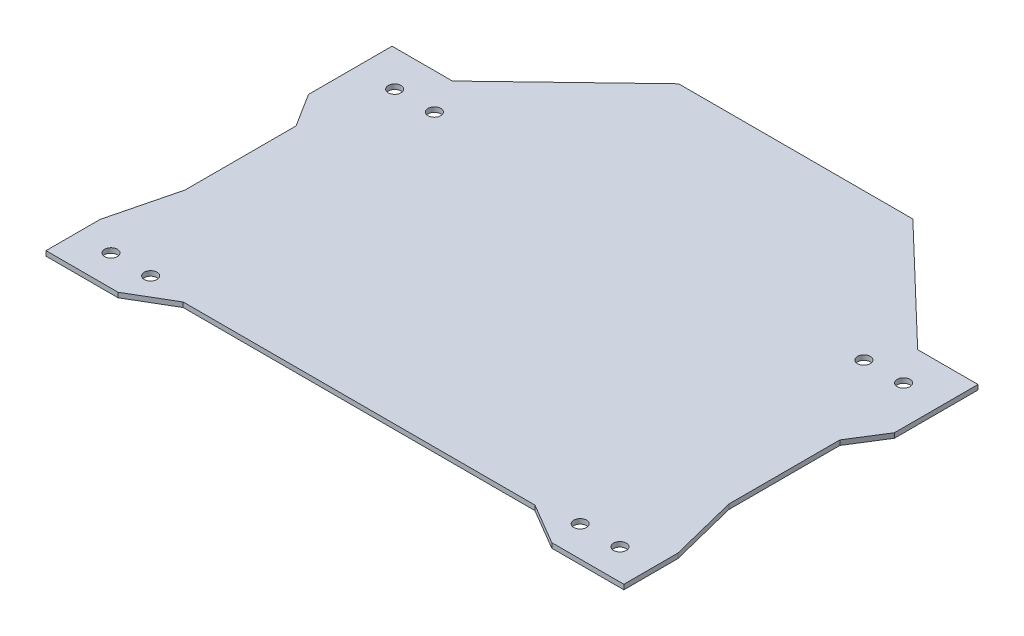
from build123d import *

# Parameters (mm, degrees)
SKETCH1_R           = 2.25
BOSS_EXTRUDE1_DEPTH = 1.7


with BuildPart() as part:
    # Sketch1 → Boss-Extrude1 (new body)
    with BuildSketch(Plane(origin=(0, 0, 0), x_dir=(1, 0, 0), z_dir=(0, 1, 0))):
        Polygon((41.275, 184.522975959), (-41.275, 184.522975959), (-82, 145.494175959), (-103.26875, 145.494175959), (-103.26875, 116.051129389), (-95.84375, 104.219175959), (-95.84375, 65.098975959), (-101.84375, 41.144175959), (-101.84375, 22.094175959), (-76.44375, 22.094175959), (-61.99375, 30.598975959), (61.99375, 30.598975959), (76.44375, 22.094175959), (101.84375, 22.094175959), (101.84375, 41.144175959), (95.84375, 65.098975959), (95.84375, 104.219175959), (103.26875, 116.051129389), (103.26875, 145.494175959), (82, 145.494175959), align=None)
        with Locations((-89.69375, 32.848975959)):
            Circle(SKETCH1_R, mode=Mode.SUBTRACT)
        with Locations((-75.69375, 32.848975959)):
            Circle(SKETCH1_R, mode=Mode.SUBTRACT)
        with Locations((-89.69375, 132.844175959)):
            Circle(SKETCH1_R, mode=Mode.SUBTRACT)
        with Locations((-75.69375, 132.844175959)):
            Circle(SKETCH1_R, mode=Mode.SUBTRACT)
        with Locations((75.69375, 32.848975959)):
            Circle(SKETCH1_R, mode=Mode.SUBTRACT)
        with Locations((89.69375, 32.848975959)):
            Circle(SKETCH1_R, mode=Mode.SUBTRACT)
        with Locations((75.69375, 132.844175959)):
            Circle(SKETCH1_R, mode=Mode.SUBTRACT)
        with Locations((89.69375, 132.844175959)):
            Circle(SKETCH1_R, mode=Mode.SUBTRACT)
    extrude(amount=BOSS_EXTRUDE1_DEPTH)


solid = part.part
